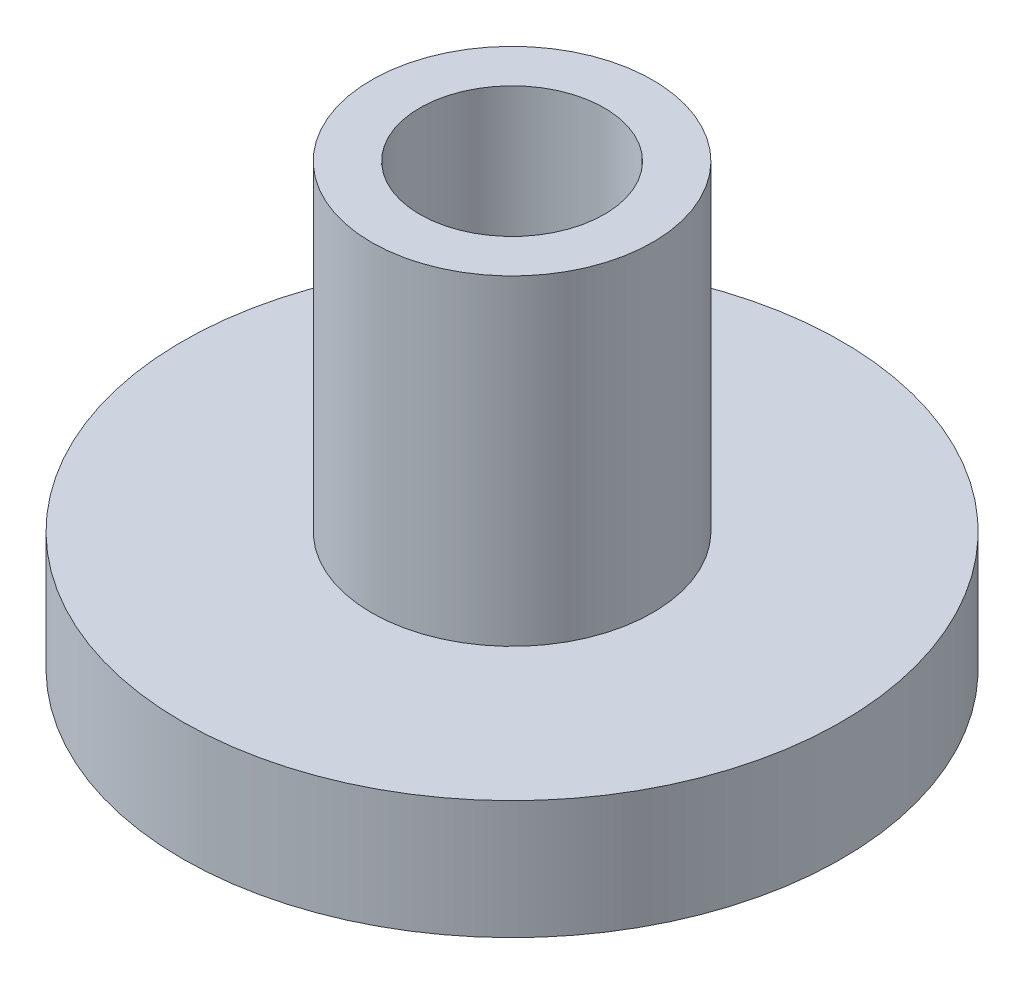
from build123d import *

# Parameters (mm, degrees)
SKETCH1_R               = 7.5
BASE_BODY_DEPTH         = 10
SKETCH2_R               = 2.1
SHAFT_BEARING_CUT_DEPTH = 15.577379737
SKETCH3_OUTSIDE_W       = 21.69
SKETCH3_OUTSIDE_H       = 21.69
SKETCH3_OUTSIDE_R       = 3.2
LATHE_CUT_DEPTH         = 7.3


with BuildPart() as part:
    # Sketch1 → base_body (new body)
    with BuildSketch(Plane(origin=(0, 0, 0), x_dir=(1, 0, 0), z_dir=(0, 1, 0))):
        Circle(SKETCH1_R)
    extrude(amount=BASE_BODY_DEPTH)

    # Sketch2 → shaft_bearing_cut (cut, through all)
    with BuildSketch(Plane(origin=(0, 10, 0), x_dir=(1, 0, 0), z_dir=(0, 1, 0))):
        Circle(SKETCH2_R)
    extrude(amount=-SHAFT_BEARING_CUT_DEPTH, mode=Mode.SUBTRACT)

    # Sketch3 outside → lathe_cut (cut)
    with BuildSketch(Plane(origin=(0, 10, 0), x_dir=(1, 0, 0), z_dir=(0, 1, 0))):
        Rectangle(SKETCH3_OUTSIDE_W, SKETCH3_OUTSIDE_H)
        Circle(SKETCH3_OUTSIDE_R, mode=Mode.SUBTRACT)
    extrude(amount=-LATHE_CUT_DEPTH, mode=Mode.SUBTRACT)


solid = part.part
